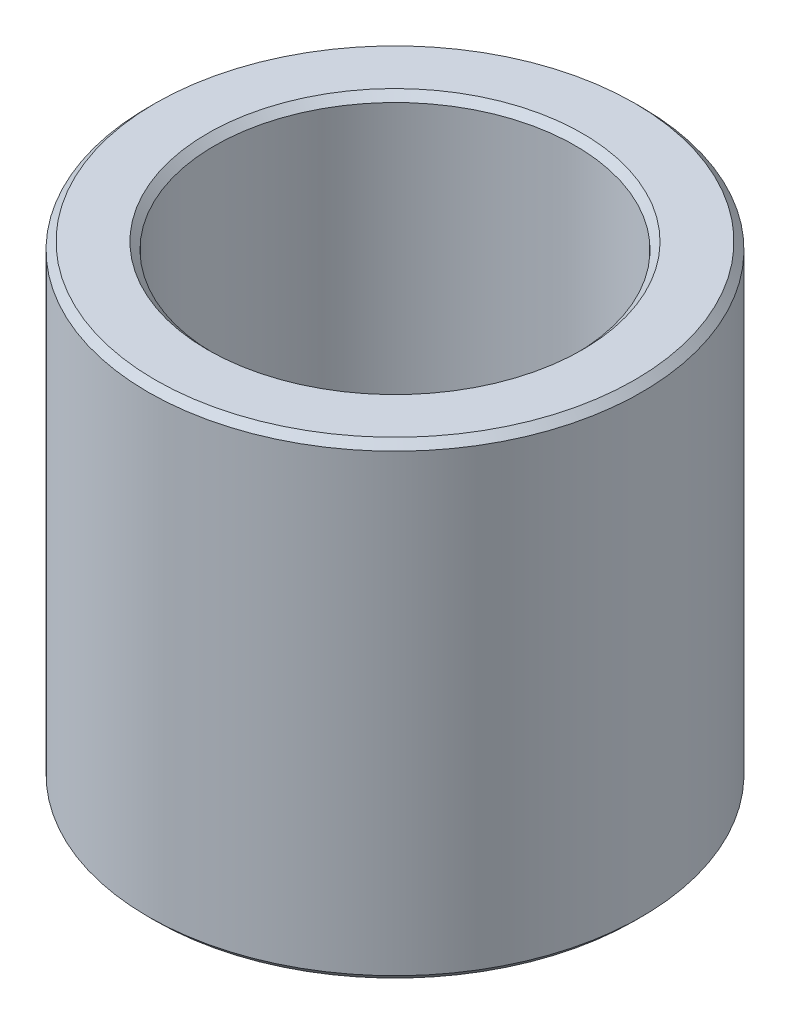
from build123d import *

# Parameters (mm, degrees)
SKETCH1_R           = 25
BOSS_EXTRUDE1_DEPTH = 47.450014183
SKETCH2_R           = 18.271021007
CUT_EXTRUDE1_DEPTH  = 60.173506284
CHAMFER1_SIZE       = 0.71774894


with BuildPart() as part:
    # Sketch1 → Boss-Extrude1 (new body)
    with BuildSketch(Plane(origin=(0, 0, 0), x_dir=(1, 0, 0), z_dir=(0, 1, 0))):
        Circle(SKETCH1_R)
    extrude(amount=BOSS_EXTRUDE1_DEPTH)

    # Sketch2 → Cut-Extrude1 (cut, through all)
    with BuildSketch(Plane(origin=(0, 0, 0), x_dir=(1, 0, 0), z_dir=(0, 1, 0))):
        Circle(SKETCH2_R)
    extrude(amount=CUT_EXTRUDE1_DEPTH, mode=Mode.SUBTRACT)

    # Chamfer1
    chamfer1_edges = [part.edges().sort_by_distance(p)[0] for p in [
        (-18.271021007, 47.450014183, 0),
        (-18.271021007, 0, 0),
        (-25, 0, 0),
        (-25, 47.450014183, 0),
    ]]
    chamfer(chamfer1_edges, length=CHAMFER1_SIZE)


solid = part.part
